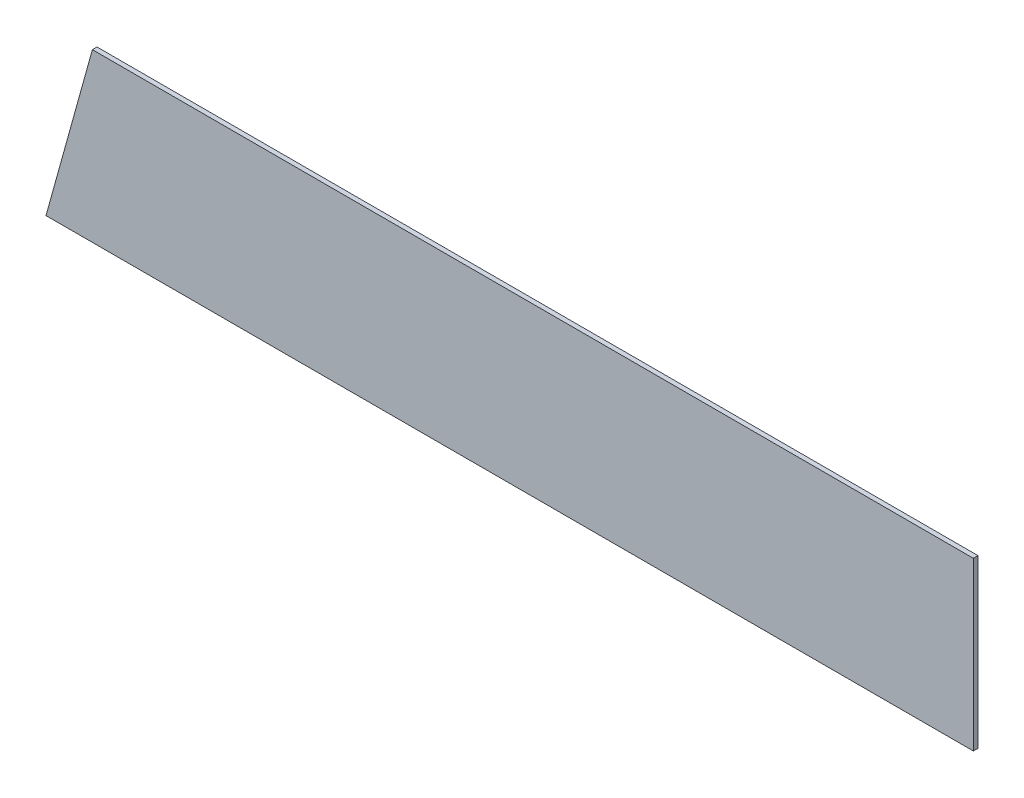
from build123d import *

# Parameters (mm, degrees)
SALIENTE_EXTRUIR1_DEPTH = 0.5


with BuildPart() as part:
    # Croquis1 → Saliente-Extruir1 (new body)
    with BuildSketch(Plane.XY):
        Polygon((-40.990604717, 8.278308849), (54.009395283, 8.278308849), (54.009395283, -9.721691151), (-45.990604717, -9.721691151), align=None)
    extrude(amount=SALIENTE_EXTRUIR1_DEPTH)


solid = part.part
